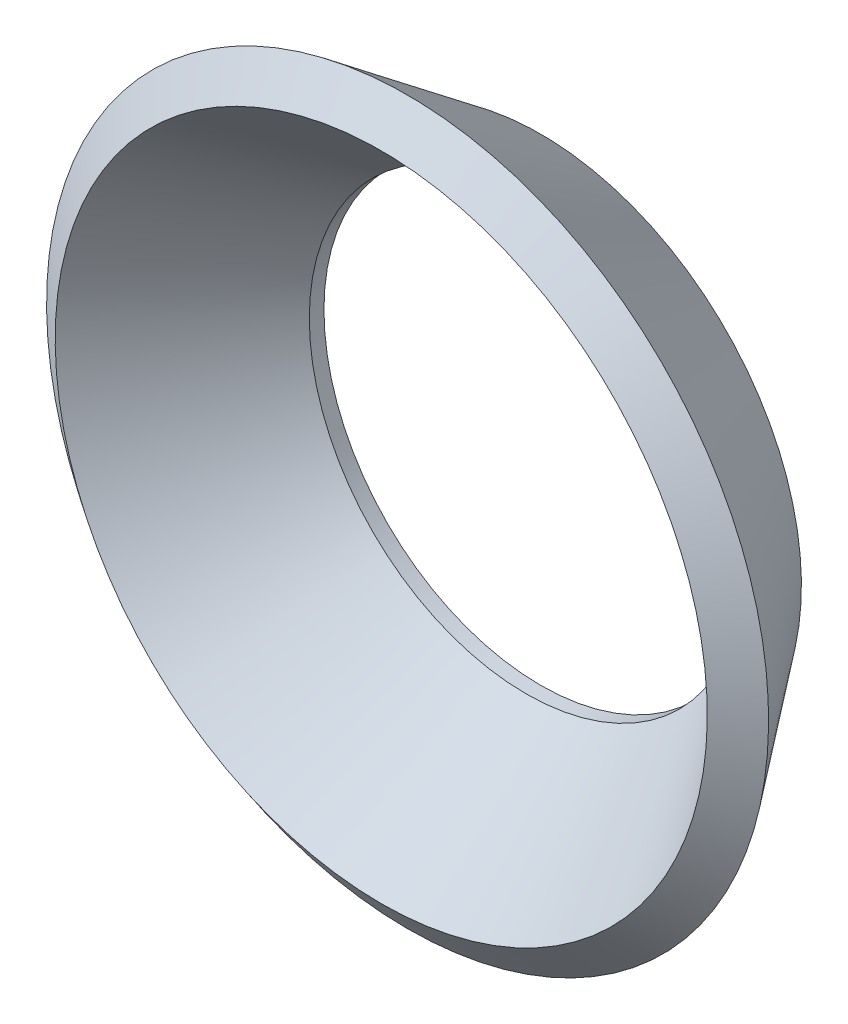
from build123d import *


with BuildPart() as part:
    # Sketch2 → Revolve1 (revolve)
    with BuildSketch(Plane(origin=(0, 0, 0), x_dir=(0, 0, -1), z_dir=(1, 0, 0))):
        Polygon((0, 6.35), (-3.245654713, 8.795776254), (-3.88767098, 7.943791892), (-0.642016267, 5.498015638), (-0.356946287, 5.2832), (0, 5.2832), align=None)
    revolve(axis=Axis((0, 0, 0), (0, 0, -1)))


solid = part.part
